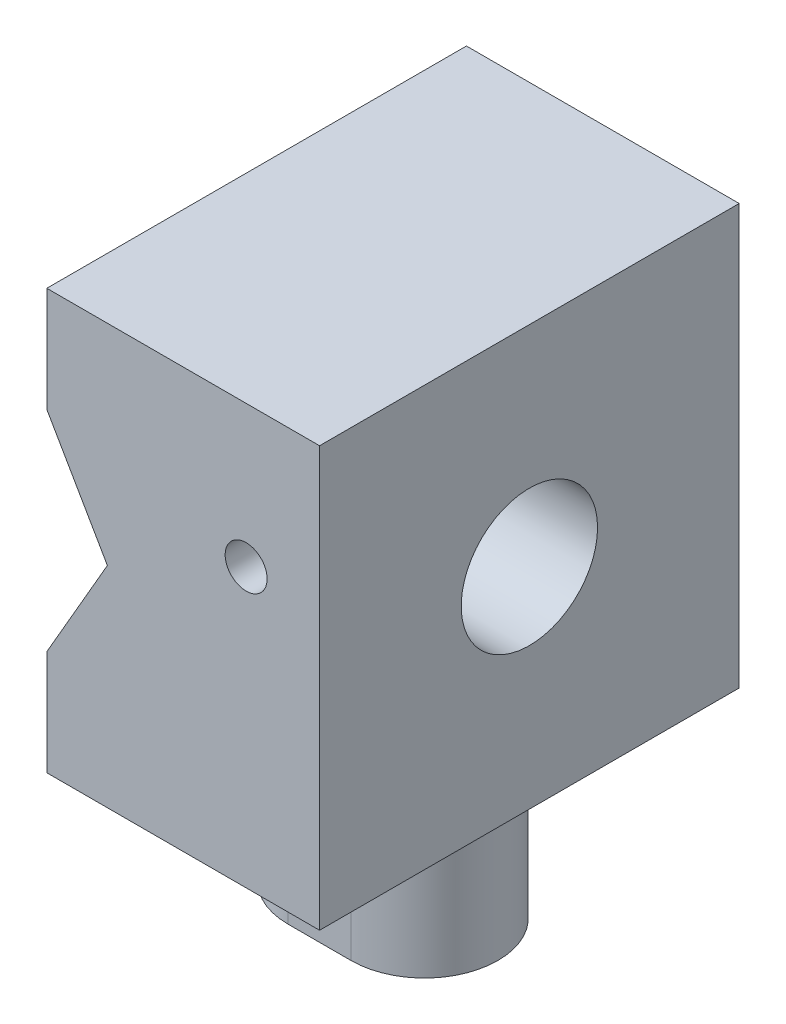
from build123d import *

# Parameters (mm, degrees)
RESSALTO_EXTRUS_O1_DEPTH                       = 40
ESBO_O2_R                                      = 6.5
CORTE_EXTRUS_O1_DEPTH                          = 19
CHANFRO1_SIZE2                                 = 6.5
CHANFRO1_SIZE                                  = 4
ESBO_O3_R                                      = 2
CORTE_EXTRUS_O2_DEPTH                          = 59.307816613
RESSALTO_EXTRUS_O2_DEPTH                       = 14
BROCA_DE_ROSQUEAR_PARA_TARRAXA_DE_5_16_1_D     = 6.5278
BROCA_DE_ROSQUEAR_PARA_TARRAXA_DE_5_16_1_DEPTH = 13
BROCA_DE_ROSQUEAR_PARA_TARRAXA_DE_5_16_1_TIP   = 1.961148974


with BuildPart() as part:
    # Esboço1 → Ressalto-extrusão1 (new body)
    with BuildSketch(Plane.XY):
        Polygon((-11.864884923, 0), (14.135115077, 0), (14.135115077, 40), (-11.864884923, 40), (-11.864884923, 30), (-6.091382231, 20), (-11.864884923, 10), align=None)
    extrude(amount=-RESSALTO_EXTRUS_O1_DEPTH)

    # Esboço2 → Corte-extrusão1 (cut)
    with BuildSketch(Plane(origin=(14.135115077, 0, 0), x_dir=(0, 0, -1), z_dir=(1, 0, 0))):
        with Locations((20, 20)):
            Circle(ESBO_O2_R)
    extrude(amount=-CORTE_EXTRUS_O1_DEPTH, mode=Mode.SUBTRACT)

    # Chanfro1
    chanfro1_edges = [part.edges().sort_by_distance(p)[0] for p in [
        (-4.864884923, 20, -13.5),
    ]]
    chanfro1_side = [part.faces().sort_by_distance(p)[0] for p in [
        (-4.784884923, 20, -13.5),
    ]]
    chamfer(chanfro1_edges, length=CHANFRO1_SIZE - 0.0001, length2=CHANFRO1_SIZE2 - 0.0001, reference=chanfro1_side[0])  # a hair under: the kernel refuses the full size

    # Esboço3 → Corte-extrusão2 (cut, through all)
    with BuildSketch(Plane.XY):
        with Locations((7.135115077, 26.5)):
            Circle(ESBO_O3_R)
    extrude(amount=-CORTE_EXTRUS_O2_DEPTH, mode=Mode.SUBTRACT)

    # Esboço4 → Ressalto-extrusão2 (add)
    with BuildSketch(Plane.XZ):
        with BuildLine():
            Line((-1.864884923, -13), (4.135115077, -13))
            ThreePointArc((4.135115077, -13), (11.135115077, -20), (4.135115077, -27))
            Line((4.135115077, -27), (-1.864884923, -27))
            ThreePointArc((-1.864884923, -27), (-8.864884923, -20), (-1.864884923, -13))
        make_face()
    extrude(amount=RESSALTO_EXTRUS_O2_DEPTH)

    # Broca de rosquear para tarraxa de 5/16-181
    with Locations(Plane(origin=(0, -14, 0), x_dir=(-1, 0, 0), z_dir=(0, -1, 0))):
        with Locations((-1.135115077, 20)):
            Hole(BROCA_DE_ROSQUEAR_PARA_TARRAXA_DE_5_16_1_D / 2, depth=BROCA_DE_ROSQUEAR_PARA_TARRAXA_DE_5_16_1_DEPTH)
            with Locations((0, 0, -(BROCA_DE_ROSQUEAR_PARA_TARRAXA_DE_5_16_1_DEPTH + BROCA_DE_ROSQUEAR_PARA_TARRAXA_DE_5_16_1_TIP / 2))):  # 118° drill point
                Cone(0, BROCA_DE_ROSQUEAR_PARA_TARRAXA_DE_5_16_1_D / 2, BROCA_DE_ROSQUEAR_PARA_TARRAXA_DE_5_16_1_TIP, mode=Mode.SUBTRACT)


solid = part.part
